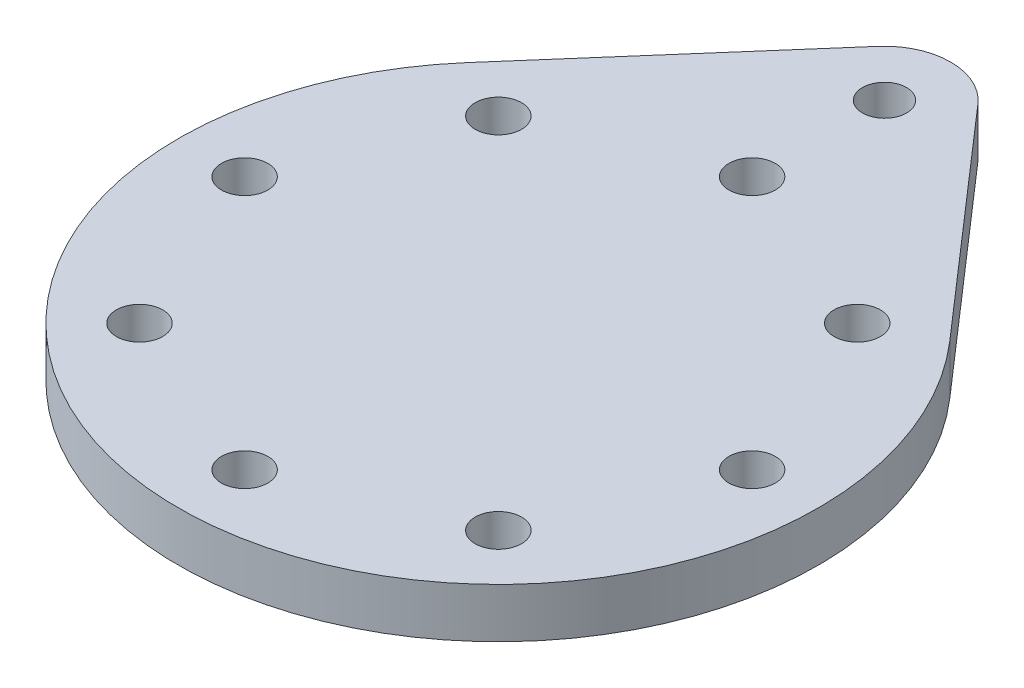
from build123d import *

# Parameters (mm, degrees)
SKETCH1_R           = 2
SKETCH1_R_2         = 2.1
BOSS_EXTRUDE1_DEPTH = 4.5


with BuildPart() as part:
    # Sketch1 → Boss-Extrude1 (new body)
    with BuildSketch(Plane(origin=(0, 0, 0), x_dir=(1, 0, 0), z_dir=(0, 1, 0))):
        with BuildLine():
            Line((-4.522596329, 38.942857143), (-21.859215588, 19.057142857))
            ThreePointArc((-21.859215588, 19.057142857), (0, -29), (21.859215588, 19.057142857))
            Line((21.859215588, 19.057142857), (4.522596329, 38.942857143))
            ThreePointArc((4.522596329, 38.942857143), (0, 41), (-4.522596329, 38.942857143))
        make_face()
        with Locations((0, 35)):
            Circle(SKETCH1_R, mode=Mode.SUBTRACT)
        with Locations((16.263455967, 16.263455967)):
            Circle(SKETCH1_R_2, mode=Mode.SUBTRACT)
        with Locations((-16.263455967, -16.263455967)):
            Circle(SKETCH1_R_2, mode=Mode.SUBTRACT)
        with Locations((-23, 0)):
            Circle(SKETCH1_R_2, mode=Mode.SUBTRACT)
        with Locations((0, -23)):
            Circle(SKETCH1_R_2, mode=Mode.SUBTRACT)
        with Locations((16.263455967, -16.263455967)):
            Circle(SKETCH1_R_2, mode=Mode.SUBTRACT)
        with Locations((23, 0)):
            Circle(SKETCH1_R_2, mode=Mode.SUBTRACT)
        with Locations((-16.263455967, 16.263455967)):
            Circle(SKETCH1_R_2, mode=Mode.SUBTRACT)
        with Locations((0, 23)):
            Circle(SKETCH1_R_2, mode=Mode.SUBTRACT)
    extrude(amount=BOSS_EXTRUDE1_DEPTH)


solid = part.part
